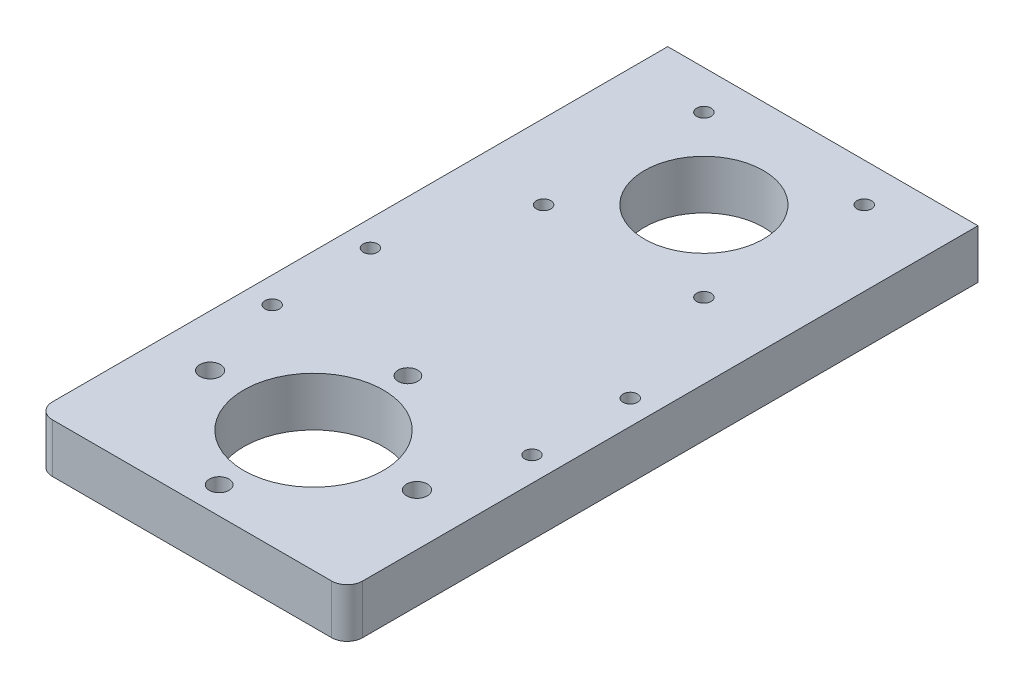
from build123d import *

# Parameters (mm, degrees)
SKETCH_1_W           = 60
SKETCH_1_H           = 63
EXTRUDE_1_DEPTH      = 9.5
FILLET_1_R           = 3
SKETCH_3_R           = 13.5
CUT_EXTRUDE_2_DEPTH  = 47.221542112
SKETCH_5_R           = 1.4
CUT_EXTRUDE_4_DEPTH  = 47.221542112
SKETCH_7_R           = 4
CUT_EXTRUDE_6_DEPTH  = 4.5
SKETCH_8_R           = 2
CUT_EXTRUDE_7_DEPTH  = 47.221542112
SKETCH_10_R          = 1.9
CUT_EXTRUDE_9_DEPTH  = 47.221542112
SKETCH_11_W          = 60
SKETCH_11_H          = 9.5
EXTRUDE_2_DEPTH      = 59
SKETCH_12_R          = 11.5
CUT_EXTRUDE_10_DEPTH = 94.642420836
SKETCH_13_R          = 1.4
CUT_EXTRUDE_11_DEPTH = 94.642420836
SKETCH_15_R          = 3.4
CUT_EXTRUDE_13_DEPTH = 4.5


with BuildPart() as part:
    # 草图1 → 凸台-拉伸1 (new body)
    with BuildSketch(Plane(origin=(0, 0, 0), x_dir=(1, 0, 0), z_dir=(0, 1, 0))):
        with Locations((0.04232978, -2.317737604)):
            Rectangle(SKETCH_1_W, SKETCH_1_H)
    extrude(amount=EXTRUDE_1_DEPTH)

    # 圆角1
    fillet_1_edges = [part.edges().sort_by_distance(p)[0] for p in [
        (30.04232978, 4.75, 33.817737604),
        (-29.95767022, 4.75, 33.817737604),
    ]]
    fillet(fillet_1_edges, radius=FILLET_1_R)

    # 草图3 → 切除-拉伸2 (cut, through all)
    with BuildSketch(Plane(origin=(0, 9.5, 0), x_dir=(1, 0, 0), z_dir=(0, 1, 0))):
        with Locations((0.04232978, -10.317737604)):
            Circle(SKETCH_3_R)
    extrude(amount=-CUT_EXTRUDE_2_DEPTH, mode=Mode.SUBTRACT)

    # 草图5 → 切除-拉伸4 (cut, through all)
    with BuildSketch(Plane(origin=(0, 9.5, 0), x_dir=(1, 0, 0), z_dir=(0, 1, 0))):
        with Locations((25.29232978, 25.685184597)):
            Circle(SKETCH_5_R)
        with Locations((25.29232978, 6.685184597)):
            Circle(SKETCH_5_R)
        with Locations((-24.95767022, 25.685184597)):
            Circle(SKETCH_5_R)
        with Locations((-24.95767022, 6.685184597)):
            Circle(SKETCH_5_R)
    extrude(amount=-CUT_EXTRUDE_4_DEPTH, mode=Mode.SUBTRACT)

    # 草图7 → 切除-拉伸6 (cut)
    with BuildSketch(Plane.XZ):
        with Locations((-19.95767022, 10.314815403)):
            Circle(SKETCH_7_R)
        with Locations((20.04232978, 10.314815403)):
            Circle(SKETCH_7_R)
    extrude(amount=-CUT_EXTRUDE_6_DEPTH, mode=Mode.SUBTRACT)

    # 草图8 → 切除-拉伸7 (cut, through all)
    with BuildSketch(Plane(origin=(0, 9.5, 0), x_dir=(1, 0, 0), z_dir=(0, 1, 0))):
        with Locations((-19.95767022, -10.314815403)):
            Circle(SKETCH_8_R)
        with Locations((20.04232978, -10.314815403)):
            Circle(SKETCH_8_R)
    extrude(amount=-CUT_EXTRUDE_7_DEPTH, mode=Mode.SUBTRACT)

    # 草图10 → 切除-拉伸9 (cut, through all)
    with BuildSketch(Plane(origin=(0, 9.5, 0), x_dir=(1, 0, 0), z_dir=(0, 1, 0))):
        with Locations((0.04232978, 7.932262396)):
            Circle(SKETCH_10_R)
        with Locations((0.04232978, -28.567737604)):
            Circle(SKETCH_10_R)
    extrude(amount=-CUT_EXTRUDE_9_DEPTH, mode=Mode.SUBTRACT)

    # 草图11 → 凸台-拉伸2 (add)
    with BuildSketch(Plane(origin=(0, 0, -29.182262396), x_dir=(-1, 0, 0), z_dir=(0, 0, -1))):
        with Locations((-0.04232978, 4.75)):
            Rectangle(SKETCH_11_W, SKETCH_11_H)
    extrude(amount=EXTRUDE_2_DEPTH)

    # 草图12 → 切除-拉伸10 (cut, through all)
    with BuildSketch(Plane.XZ):
        with Locations((0.033863824, -65.183068008)):
            Circle(SKETCH_12_R)
    extrude(amount=-CUT_EXTRUDE_10_DEPTH, mode=Mode.SUBTRACT)

    # 草图13 → 切除-拉伸11 (cut, through all)
    with BuildSketch(Plane.XZ):
        with Locations((-15.466136176, -49.683068008)):
            Circle(SKETCH_13_R)
        with Locations((-15.466136176, -80.683068008)):
            Circle(SKETCH_13_R)
        with Locations((15.533863824, -80.683068008)):
            Circle(SKETCH_13_R)
        with Locations((15.533863824, -49.683068008)):
            Circle(SKETCH_13_R)
    extrude(amount=-CUT_EXTRUDE_11_DEPTH, mode=Mode.SUBTRACT)

    # 草图15 → 切除-拉伸13 (cut)
    with BuildSketch(Plane.XZ):
        with Locations((-24.95767022, -6.685184597)):
            Circle(SKETCH_15_R)
        with Locations((-24.95767022, -25.685184597)):
            Circle(SKETCH_15_R)
        with Locations((25.29232978, -6.685184597)):
            Circle(SKETCH_15_R)
        with Locations((25.29232978, -25.685184597)):
            Circle(SKETCH_15_R)
    extrude(amount=-CUT_EXTRUDE_13_DEPTH, mode=Mode.SUBTRACT)


solid = part.part
